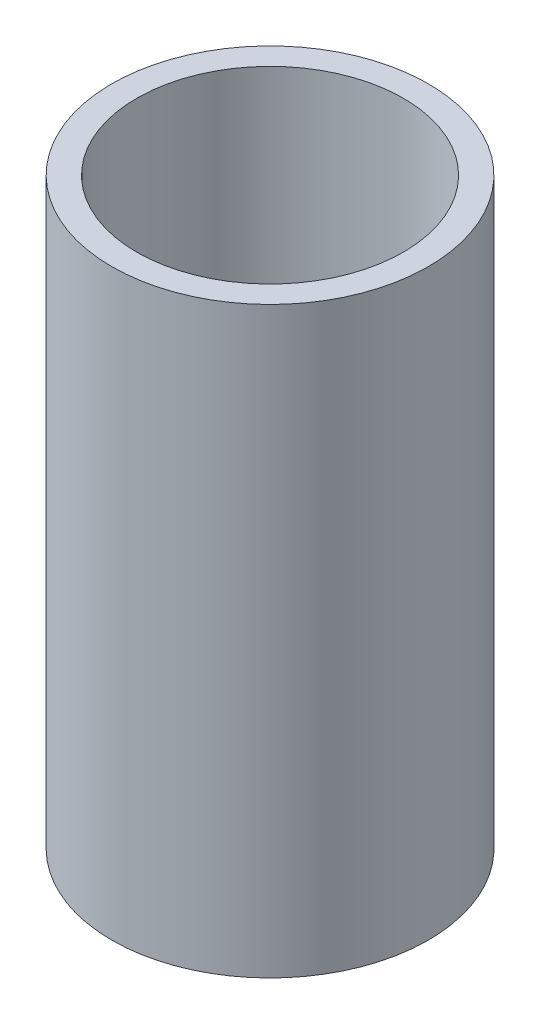
from build123d import *

# Parameters (mm, degrees)
SKETCH1_R           = 24.13
SKETCH1_R_2         = 20.32
BOSS_EXTRUDE1_DEPTH = 88.9


with BuildPart() as part:
    # Sketch1 → Boss-Extrude1 (new body)
    with BuildSketch(Plane(origin=(0, 0, 0), x_dir=(1, 0, 0), z_dir=(0, 1, 0))):
        Circle(SKETCH1_R)
        Circle(SKETCH1_R_2, mode=Mode.SUBTRACT)
    extrude(amount=BOSS_EXTRUDE1_DEPTH)


solid = part.part
